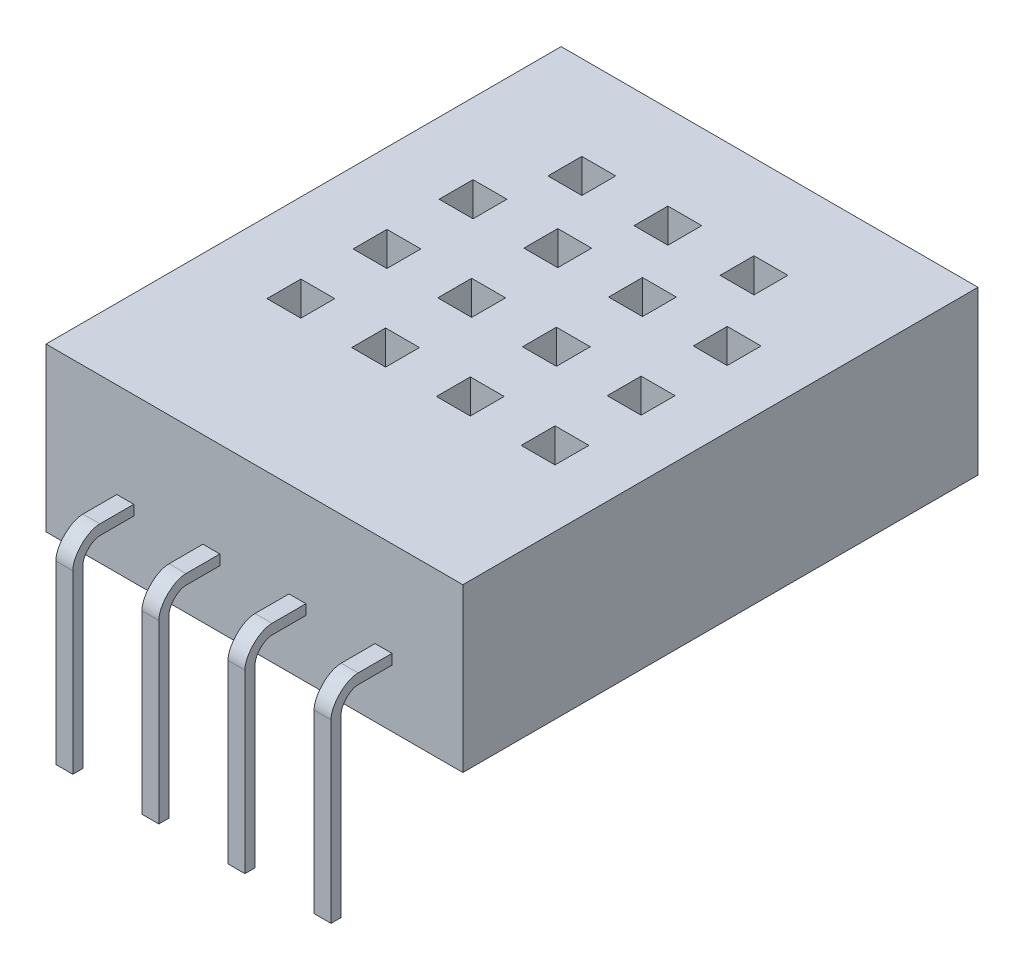
from build123d import *

# Parameters (mm, degrees)
SKETCH_1_W                  = 12.3
SKETCH_1_H                  = 15.2
EXTRUDE_1_DEPTH             = 4.8
SKETCH_2_W                  = 0.5
SKETCH_2_H                  = 0.3
EXTRUDE_2_DEPTH             = 1
EXTRUDE_3_DEPTH             = 1.2
EXTRUDE_3_DEPTH_BACK        = 4
SKETCH_5_W                  = 0.5
SKETCH_5_H                  = 0.3
LOFT_START                  = 3.56
LOFT_1_DEPTH                = 0.5
PATTERN_LINEAR_1_COUNT      = 4
PATTERN_LINEAR_1_PITCH      = 2.54
SKETCH_3_W                  = 1
SKETCH_3_H                  = 1
CUT_EXTRUDE_1_DEPTH         = 2
PATTERN_LINEAR_2_COUNT      = 2
PATTERN_LINEAR_2_PITCH      = 2.54
PATTERN_LINEAR_2_COL_COUNT  = 2
PATTERN_LINEAR_2_COL_PITCH  = 2.54
SKETCH_4_W                  = 1
SKETCH_4_H                  = 1
CUT_EXTRUDE_2_DEPTH         = 2
PATTERN_LINEAR_3_COUNT      = 4
PATTERN_LINEAR_3_PITCH      = 2.5
PATTERN_LINEAR_3_COUNT_DIR2 = 3
PATTERN_LINEAR_3_PITCH_DIR2 = 2.54


# Read off the part's stored shape, not the designer's step: По сечениям1
with BuildPart() as part:
    # Эскиз1 → Бобышка-Вытянуть1 (new body)
    with BuildSketch(Plane(origin=(0, 0, 0), x_dir=(1, 0, 0), z_dir=(0, 1, 0))):
        Rectangle(SKETCH_1_W, SKETCH_1_H)
    extrude(amount=EXTRUDE_1_DEPTH)

    # Эскиз3 → Вырез-Вытянуть1 (cut)
    with BuildSketch(Plane(origin=(0, 4.8, 0), x_dir=(1, 0, 0), z_dir=(0, 1, 0))):
        with Locations((0, 4.6)):
            Rectangle(SKETCH_3_W, SKETCH_3_H)
    cut_extrude_1 = extrude(amount=-CUT_EXTRUDE_1_DEPTH, mode=Mode.SUBTRACT)

    # Линейный массив2: Вырез-Вытянуть1 ×2
    with Locations(*[(i * PATTERN_LINEAR_2_PITCH, 0, 0) for i in range(1, PATTERN_LINEAR_2_COUNT)]):
        add(cut_extrude_1, mode=Mode.SUBTRACT)

    # Линейный массив2 col: Вырез-Вытянуть1 ×2
    with Locations(*[(-i * PATTERN_LINEAR_2_COL_PITCH, 0, 0) for i in range(1, PATTERN_LINEAR_2_COL_COUNT)]):
        add(cut_extrude_1, mode=Mode.SUBTRACT)

    # Эскиз4 → Вырез-Вытянуть2 (cut)
    with BuildSketch(Plane(origin=(0, 4.8, 0), x_dir=(1, 0, 0), z_dir=(0, 1, 0))):
        with Locations((3.95, 2.4)):
            Rectangle(SKETCH_4_W, SKETCH_4_H)
    cut_extrude_2 = extrude(amount=-CUT_EXTRUDE_2_DEPTH, mode=Mode.SUBTRACT)

    # Линейный массив3: Cut-Extrude 2 4 × 3
    with Locations(*[(-i * PATTERN_LINEAR_3_PITCH, 0, j * PATTERN_LINEAR_3_PITCH_DIR2) for i in range(PATTERN_LINEAR_3_COUNT) for j in range(PATTERN_LINEAR_3_COUNT_DIR2) if (i, j) != (0, 0)]):
        add(cut_extrude_2, mode=Mode.SUBTRACT)


with BuildPart() as body_2:
    # Эскиз2 → Бобышка-Вытянуть2 (new body)
    with BuildSketch(Plane.XY.offset(7.6)):
        with Locations((3.81, 1.85)):
            Rectangle(SKETCH_2_W, SKETCH_2_H)
    extrude(amount=EXTRUDE_2_DEPTH)



with BuildPart() as body_3:
    # Эскиз5 → Бобышка-Вытянуть3 (new, two sides: drawn at the far end of the back side and taken through both)
    with BuildSketch(Plane(origin=(0, 0, 0), x_dir=(1, 0, 0), z_dir=(0, 1, 0)).offset(-EXTRUDE_3_DEPTH_BACK)):
        with Locations((3.81, -9.25)):
            Rectangle(SKETCH_5_W, SKETCH_5_H)
    extrude(amount=EXTRUDE_3_DEPTH + EXTRUDE_3_DEPTH_BACK)


with BuildPart() as body_2_1:
    add(body_2.part)

    add(body_3.part)  # По сечениям1 merges body 3
    # По сечениям1 outline → По сечениям1 (add)
    with BuildSketch(Plane.YZ.offset(LOFT_START)):
        with BuildLine():
            add(Edge.make_bspline(
                [(1.7, 8.6), (1.7, 8.83570226), (1.43570226, 9.1), (1.2, 9.1)],
                knots=[0, 0, 0, 0, 1, 1, 1, 1], degree=3))
            Line((1.7, 8.6), (2, 8.6))
            add(Edge.make_bspline(
                [(2, 8.6), (2, 8.977123617), (1.577123617, 9.4), (1.2, 9.4)],
                knots=[0, 0, 0, 0, 1, 1, 1, 1], degree=3))
            Line((1.2, 9.4), (1.2, 9.1))
        make_face()
    extrude(amount=LOFT_1_DEPTH)


with BuildPart() as pattern_linear_1_1:
    # Линейный массив1: pattern copy
    add(body_2_1.part.moved(Location(Vector(-1, 0, 0) * (1 * PATTERN_LINEAR_1_PITCH))))


with BuildPart() as pattern_linear_1_2:
    # Линейный массив1: pattern copy
    add(body_2_1.part.moved(Location(Vector(-1, 0, 0) * (2 * PATTERN_LINEAR_1_PITCH))))


with BuildPart() as pattern_linear_1_3:
    # Линейный массив1: pattern copy
    add(body_2_1.part.moved(Location(Vector(-1, 0, 0) * (3 * PATTERN_LINEAR_1_PITCH))))


solid = Compound([part.part, body_2_1.part, pattern_linear_1_1.part, pattern_linear_1_2.part, pattern_linear_1_3.part])
